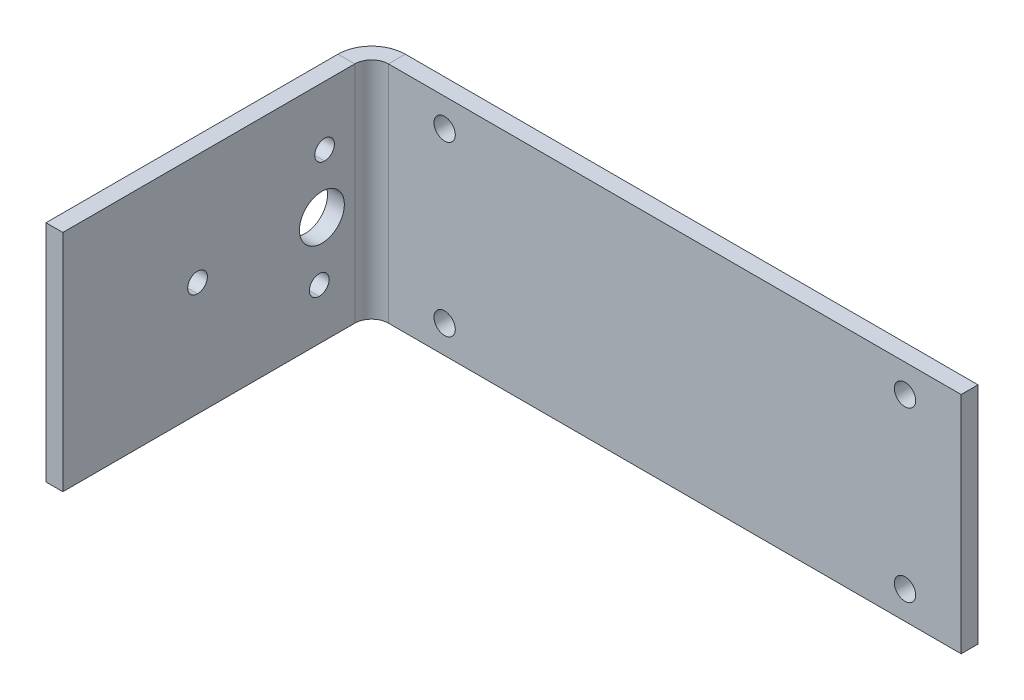
from build123d import *

# Parameters (mm, degrees)
SKETCH1_W                    = 105
SKETCH1_H                    = 40
BASE_FLANGE1_DEPTH           = 3
EDGE_FLANGE1_STRIP_W         = 18
EDGE_FLANGE1_STRIP_H         = 3
EDGE_FLANGE1_STRIP_CUT_DEPTH = 40
EDGE_FLANGE1_DEPTH           = 40
F_25_0_1495_DIAMETER_SLOT1_D = 3.7973
F_3_0MM_START                = -37.361157767
F_3_0MM_DOWEL_SLOT1_DEPTH    = 3
F_3_0MM_DOWEL_SLOT2_D        = 8


# Read off the part's stored shape, not the designer's step: Ø3.0mm Dowel Slot1
# Sheet-metal steps are written as plain solids
with BuildPart() as part:
    # Sketch1 → Base-Flange1 (new body)
    with BuildSketch(Plane.XY):
        with Locations((18.138842233, 4.62628866)):
            Rectangle(SKETCH1_W, SKETCH1_H)
    extrude(amount=-BASE_FLANGE1_DEPTH)

    # Edge-Flange1 strip (across the edge) → Edge-Flange1 strip cut (cut)
    with BuildSketch(Plane(origin=(-34.361157767, 24.62628866, 0), x_dir=(1, 0, 0), z_dir=(0, -1, 0))):
        with Locations((-6, -1.5)):
            Rectangle(EDGE_FLANGE1_STRIP_W, EDGE_FLANGE1_STRIP_H)
    extrude(amount=EDGE_FLANGE1_STRIP_CUT_DEPTH, mode=Mode.SUBTRACT)

    # Edge-Flange1 section (across the edge) → Edge-Flange1 (add)
    with BuildSketch(Plane(origin=(-34.361157767, 24.62628866, 0), x_dir=(1, 0, 0), z_dir=(0, -1, 0))):
        with BuildLine():
            Line((-3, 3), (-3, 55))
            Line((-3, 55), (0, 55))
            Line((0, 55), (0, 3))
            ThreePointArc((0, 3), (0.878679656, 0.878679656), (3, 0))
            Line((3, 0), (3, -3))
            ThreePointArc((3, -3), (-1.242640687, -1.242640687), (-3, 3))
        make_face()
    extrude(amount=EDGE_FLANGE1_DEPTH)

    # #25 (0.1495) Diameter Slot1 (through all)
    with Locations(Plane(origin=(0, 0, -3), x_dir=(-1, 0, 0), z_dir=(0, 0, -1))):
        with Locations((-60.638842233, 19.62628866), (-60.638842233, -10.37371134), (21.361157767, -10.37371134), (21.361157767, 19.62628866)):
            Hole(F_25_0_1495_DIAMETER_SLOT1_D / 2)

    # Ø3.0mm Dowel Slot1 outline → Ø3.0mm Dowel Slot1 (cut)
    with BuildSketch(Plane.YZ.offset(F_3_0MM_START)):
        with BuildLine():
            Line((6.67117218, 31.008782935), (6.671169071, 31.013782934))
            ThreePointArc((6.671169071, 31.013782934), (4.920081294, 32.762694482), (3.171169747, 31.011606705))
            Line((3.171169747, 31.011606705), (3.171172856, 31.006606706))
            ThreePointArc((3.171172856, 31.006606706), (4.922260632, 29.257695159), (6.67117218, 31.008782935))
        make_face()
        with BuildLine():
            Line((-4.562452858, 9.334806586), (-4.562455966, 9.339806585))
            ThreePointArc((-4.562455966, 9.339806585), (-6.313543742, 11.088718132), (-8.06245529, 9.337630356))
            Line((-8.06245529, 9.337630356), (-8.062452181, 9.332630357))
            ThreePointArc((-8.062452181, 9.332630357), (-6.311364405, 7.583718809), (-4.562452858, 9.334806586))
        make_face()
        with BuildLine():
            Line((15.836935374, 8.38259529), (15.836932265, 8.387595289))
            ThreePointArc((15.836932265, 8.387595289), (14.085844489, 10.136506836), (12.336932941, 8.38541906))
            Line((12.336932941, 8.38541906), (12.33693605, 8.380419061))
            ThreePointArc((12.33693605, 8.380419061), (14.088023826, 6.631507514), (15.836935374, 8.38259529))
        make_face()
    extrude(amount=F_3_0MM_DOWEL_SLOT1_DEPTH, mode=Mode.SUBTRACT)

    # Ø3.0mm Dowel Slot2 (through all)
    with Locations(Plane.ZY.offset(37.361157767)):
        with Locations((8.860112823, 3.887240042)):
            Hole(F_3_0MM_DOWEL_SLOT2_D / 2)


solid = part.part
